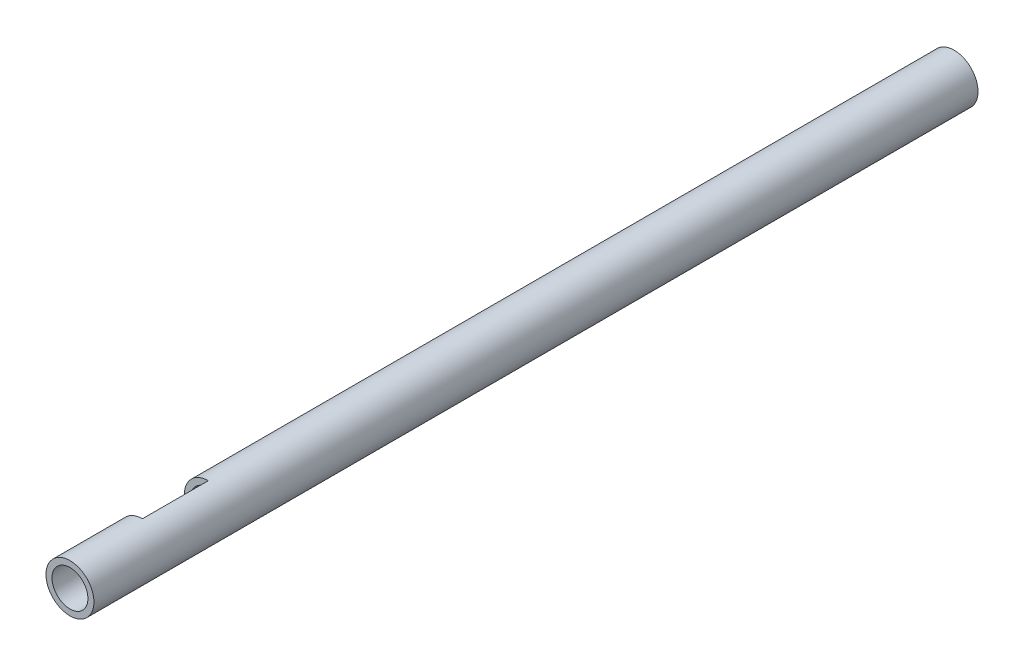
from build123d import *

# Parameters (mm, degrees)
SKETCH1_W               = 738
SKETCH1_H               = 5
CUT_EXTRUDE1_DEPTH      = 739.541806535
CUT_EXTRUDE1_DEPTH_BACK = 739.541806535
SKETCH2_W               = 37.714751534
SKETCH2_H               = 55


with BuildPart() as part:
    # Sketch1 → Revolve1 (revolve)
    with BuildSketch(Plane(origin=(0, 0, 0), x_dir=(0, 0, -1), z_dir=(1, 0, 0))):
        with Locations((-369, 17.5)):
            Rectangle(SKETCH1_W, SKETCH1_H)
    revolve(axis=Axis((0, 0, 0), (0, 0, 1)))

    # Sketch2 → Cut-Extrude1 (cut, two sides: drawn at the far end of the back side and taken through both)
    with BuildSketch(Plane(origin=(0, 0, 0), x_dir=(1, 0, 0), z_dir=(0, 1, 0)).offset(-CUT_EXTRUDE1_DEPTH_BACK)):
        with Locations((-18.857375767, -650)):
            Rectangle(SKETCH2_W, SKETCH2_H)
    extrude(amount=CUT_EXTRUDE1_DEPTH + CUT_EXTRUDE1_DEPTH_BACK, mode=Mode.SUBTRACT)


solid = part.part
